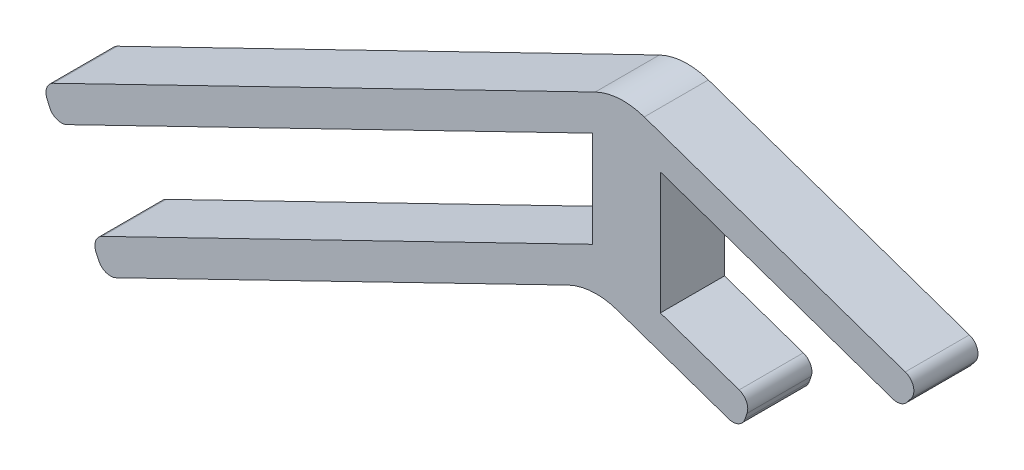
from build123d import *

# Parameters (mm, degrees)
EXTRUDE_1_DEPTH = 10
FILLET_1_R      = 10
FILLET_2_R      = 10
FILLET_5_R      = 2
FILLET_6_R      = 2


with BuildPart() as part:
    # 草圖1 → 填料-伸長1 (new body)
    with BuildSketch(Plane.XY):
        Polygon((0.928558352, 13.247145977), (-89.014023623, -30.460198344), (-87.060788638, -35.070131447), (-3.211516377, 5.676186185), (-3.211516377, -9.333389595), (-81.461562696, -47.358779154), (-79.327274384, -51.880729902), (-3.211516377, -14.892491736), (-1.101838249, -15.678587186), (19.893430075, -22.941750343), (21.532336662, -18.217980093), (7.356621283, -13.313992582), (7.356621283, 5.732665226), (44.936081287, -7.26768062), (48.180942947, -3.099479061), (7.356621283, 11.023403506), (6.383616017, 11.360007731), align=None)
    extrude(amount=EXTRUDE_1_DEPTH)

    # 圓角1
    fillet_1_edges = [part.edges().sort_by_distance(p)[0] for p in [
        (0.928558352, 13.247145977, 5),
    ]]
    fillet(fillet_1_edges, radius=FILLET_1_R)

    # 圓角2
    fillet_2_edges = [part.edges().sort_by_distance(p)[0] for p in [
        (-3.211516377, -14.892491736, 5),
    ]]
    fillet(fillet_2_edges, radius=FILLET_2_R)

    # 圓角5
    fillet_5_edges = [part.edges().sort_by_distance(p)[0] for p in [
        (19.893430075, -22.941750343, 5),
        (21.532336662, -18.217980093, 5),
        (44.936081287, -7.26768062, 5),
        (48.180942947, -3.099479061, 5),
    ]]
    fillet(fillet_5_edges, radius=FILLET_5_R)

    # 圓角6
    fillet_6_edges = [part.edges().sort_by_distance(p)[0] for p in [
        (-79.327274384, -51.880729902, 5),
        (-81.461562696, -47.358779154, 5),
        (-87.060788638, -35.070131447, 5),
        (-89.014023623, -30.460198344, 5),
    ]]
    fillet(fillet_6_edges, radius=FILLET_6_R)


solid = part.part
